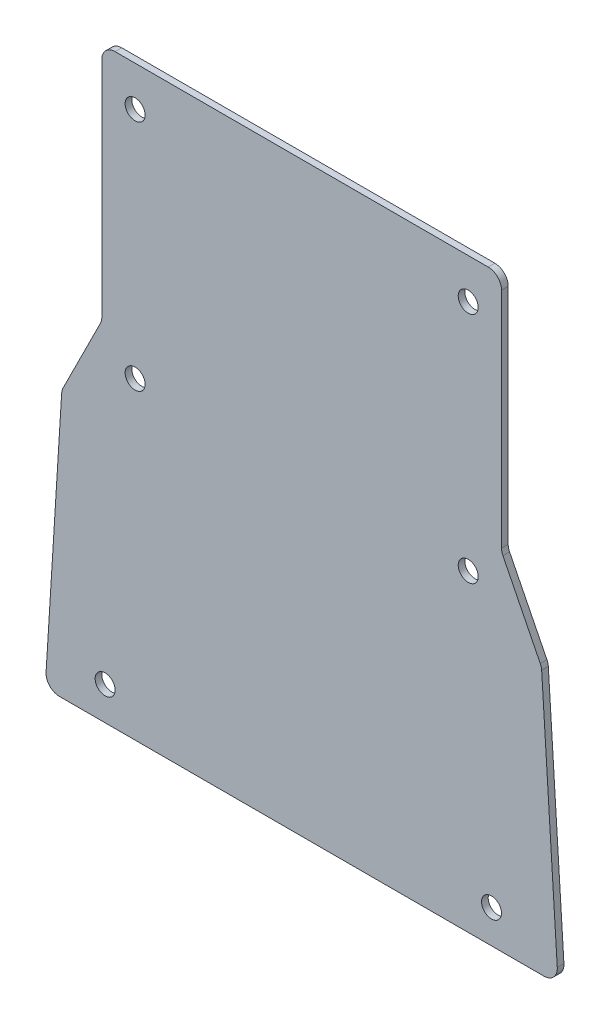
from build123d import *

# Parameters (mm, degrees)
BASE_FLANGE1_DEPTH = 1
FILLET1_R          = 2
SKETCH6_R          = 1.5
CUT_EXTRUDE1_DEPTH = 97.006984786


# Sheet-metal steps are written as plain solids
with BuildPart() as part:
    # Sketch1 → Base-Flange1 (new body)
    with BuildSketch(Plane.XY):
        Polygon((-38.5, 0), (38.5, 0), (36, 40), (30, 52), (30, 88), (-30, 88), (-30, 52), (-36, 40), align=None)
    extrude(amount=-BASE_FLANGE1_DEPTH)

    # Fillet1
    fillet1_edges = [part.edges().sort_by_distance(p)[0] for p in [
        (38.5, 0, -0.5),
        (-38.5, 0, -0.5),
        (-36, 40, -0.5),
        (-30, 52, -0.5),
        (-30, 88, -0.5),
        (30, 88, -0.5),
        (30, 52, -0.5),
        (36, 40, -0.5),
    ]]
    fillet(fillet1_edges, radius=FILLET1_R)

    # Sketch6 → Cut-Extrude1 (cut, through all)
    with BuildSketch(Plane.XY):
        with Locations((-25, 82)):
            Circle(SKETCH6_R)
        with Locations((25, 82)):
            Circle(SKETCH6_R)
        with Locations((-25, 47)):
            Circle(SKETCH6_R)
        with Locations((25, 47)):
            Circle(SKETCH6_R)
        with Locations((-29.5, 5)):
            Circle(SKETCH6_R)
        with Locations((28.5, 5)):
            Circle(SKETCH6_R)
    extrude(amount=-CUT_EXTRUDE1_DEPTH, mode=Mode.SUBTRACT)


solid = part.part
